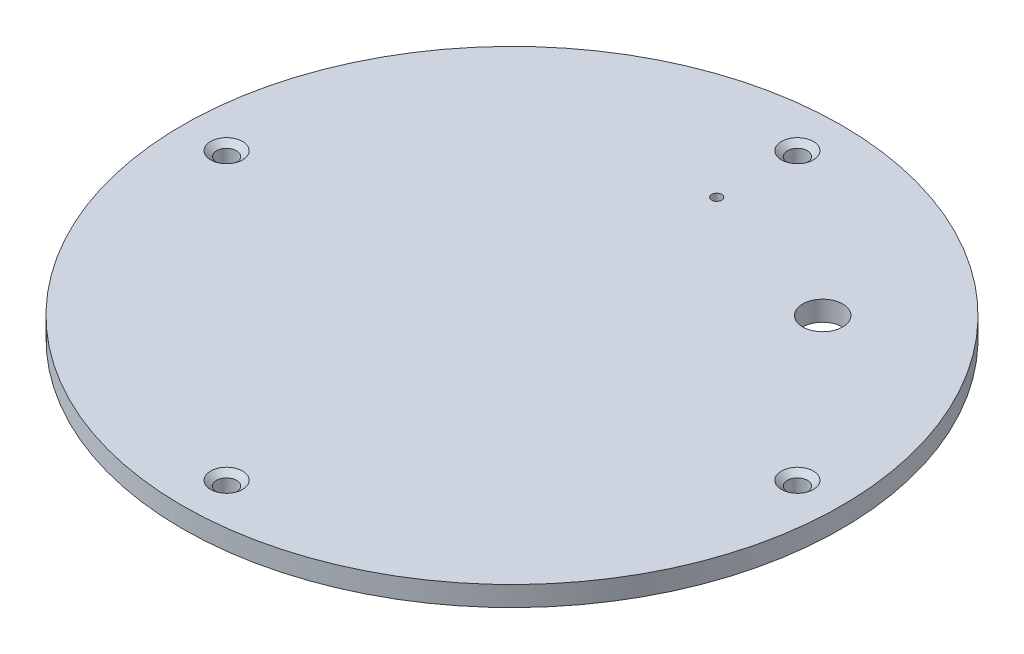
from build123d import *

# Parameters (mm, degrees)
SKETCH1_R                                       = 16.5
BOSS_EXTRUDE1_DEPTH                             = 1
CSK_FOR_M2_FLAT_HEAD_MACHINE_SCREW1_D           = 1
CSK_FOR_M2_FLAT_HEAD_MACHINE_SCREW1_CSINK_D     = 1.6
CSK_FOR_M2_FLAT_HEAD_MACHINE_SCREW1_CSINK_ANGLE = 100
CUT_EXTRUDE1_DEPTH                              = 24.355941428
CUT_EXTRUDE1_DEPTH_BACK                         = 24.355941428
SKETCH5_R                                       = 0.25
SKETCH5_R_2                                     = 1


with BuildPart() as part:
    # Sketch1 → Boss-Extrude1 (new body)
    with BuildSketch(Plane(origin=(0, 0, 0), x_dir=(1, 0, 0), z_dir=(0, 1, 0))):
        Circle(SKETCH1_R)
    extrude(amount=BOSS_EXTRUDE1_DEPTH)

    # CSK for M2 Flat Head Machine Screw1 (through all)
    with Locations(Plane(origin=(0, 1, 0), x_dir=(1, 0, 0), z_dir=(0, 1, 0))):
        with Locations((0, 14.29), (14.29, 0), (0, -14.29), (-14.29, 0)):
            CounterSinkHole(CSK_FOR_M2_FLAT_HEAD_MACHINE_SCREW1_D / 2, CSK_FOR_M2_FLAT_HEAD_MACHINE_SCREW1_CSINK_D / 2, counter_sink_angle=CSK_FOR_M2_FLAT_HEAD_MACHINE_SCREW1_CSINK_ANGLE)

    # Sketch5 → Cut-Extrude1 (cut, two sides: drawn at the far end of the back side and taken through both)
    with BuildSketch(Plane(origin=(0, 1, 0), x_dir=(1, 0, 0), z_dir=(0, 1, 0)).offset(-CUT_EXTRUDE1_DEPTH_BACK)):
        with Locations((0, 10.25)):
            Circle(SKETCH5_R)
        with Locations((7.778174593, 7.778174593)):
            Circle(SKETCH5_R_2)
    extrude(amount=CUT_EXTRUDE1_DEPTH + CUT_EXTRUDE1_DEPTH_BACK, mode=Mode.SUBTRACT)


solid = part.part
